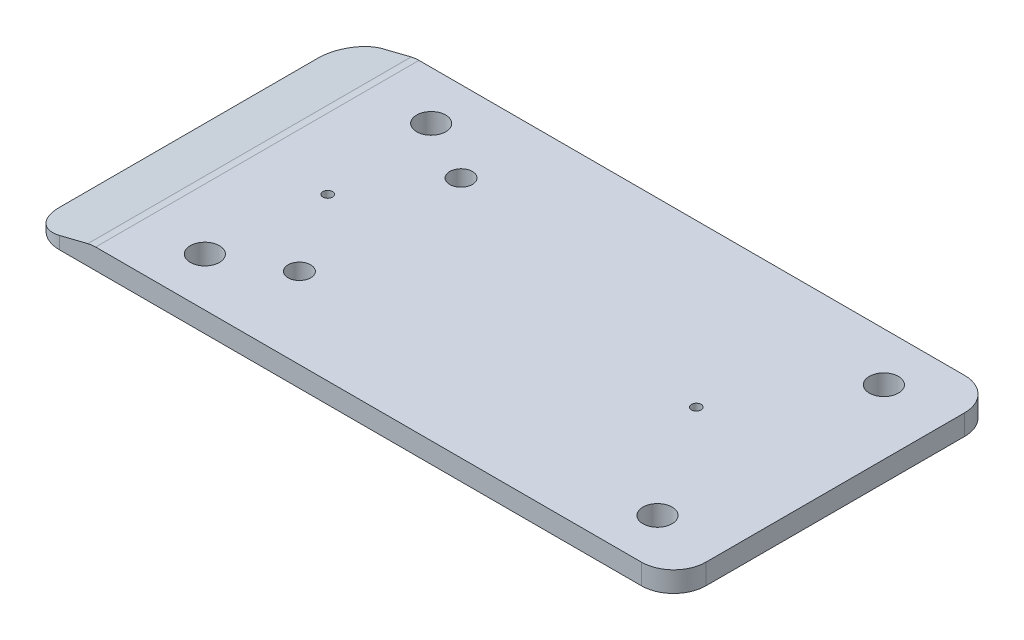
from build123d import *

# Parameters (mm, degrees)
SKETCH1_W             = 200
SKETCH1_H             = 100
BOSS_EXTRUDE1_DEPTH   = 6.35
CHAMFER1_SIZE         = 5
CHAMFER1_SIZE2        = 20
FILLET1_R             = 10
F_3_0MM_DOWEL_HOLE1_D = 3
M8_CLEARANCE_HOLE1_D  = 9
F_6_0MM_DOWEL_HOLE1_D = 7


with BuildPart() as part:
    # Sketch1 → Boss-Extrude1 (new body)
    with BuildSketch(Plane(origin=(0, 0, 0), x_dir=(1, 0, 0), z_dir=(0, 1, 0))):
        Rectangle(SKETCH1_W, SKETCH1_H)
    extrude(amount=BOSS_EXTRUDE1_DEPTH)

    # Chamfer1
    chamfer1_edges = [part.edges().sort_by_distance(p)[0] for p in [
        (-100, 6.35, 0),
    ]]
    chamfer1_side = [part.faces().sort_by_distance(p)[0] for p in [
        (-100, 3.175, 0),
    ]]
    chamfer(chamfer1_edges, length=CHAMFER1_SIZE, length2=CHAMFER1_SIZE2, reference=chamfer1_side[0])

    # Fillet1
    fillet1_edges = [part.edges().sort_by_distance(p)[0] for p in [
        (-100, 0.675, -50),
        (100, 3.175, -50),
        (100, 3.175, 50),
        (-100, 0.675, 50),
        (-80, 6.35, 0),
    ]]
    fillet(fillet1_edges, radius=FILLET1_R)

    # Ø3.0mm Dowel Hole1 (through all)
    with Locations(Plane(origin=(0, 6.35, 0), x_dir=(1, 0, 0), z_dir=(0, 1, 0))):
        with Locations((-57, 0), (57, 0)):
            Hole(F_3_0MM_DOWEL_HOLE1_D / 2)

    # M8 Clearance Hole1 (through all)
    with Locations(Plane(origin=(0, 6.35, 0), x_dir=(1, 0, 0), z_dir=(0, 1, 0))):
        with Locations((-60, 35), (80, -35), (-60, -35), (80, 35)):
            Hole(M8_CLEARANCE_HOLE1_D / 2)

    # Ø6.0mm Dowel Hole1 (through all)
    with Locations(Plane(origin=(0, 6.35, 0), x_dir=(1, 0, 0), z_dir=(0, 1, 0))):
        with Locations((-40.768943744, 25), (-40.768943744, -25)):
            Hole(F_6_0MM_DOWEL_HOLE1_D / 2)


solid = part.part
